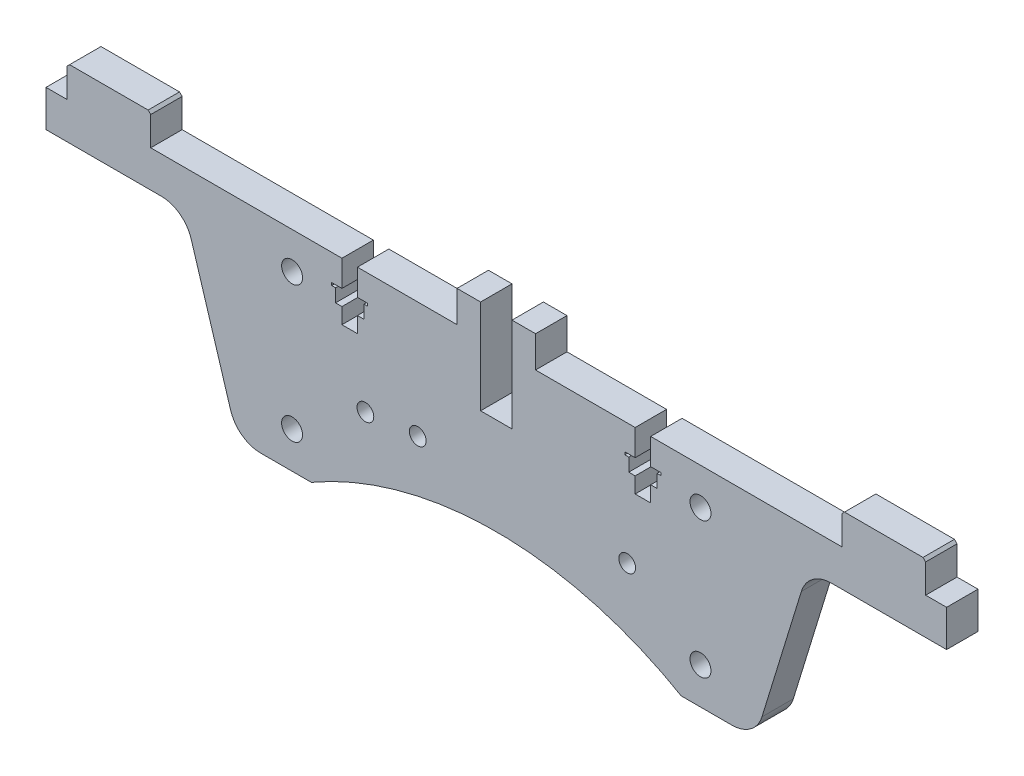
from build123d import *

# Parameters (mm, degrees)
BOSS_EXTRUDE1_DEPTH = 6
SKETCH2_R           = 2
SKETCH2_R_2         = 1.6
CUT_EXTRUDE1_DEPTH  = 91.044433476
CHAMFER1_SIZE       = 0.5
CUT_EXTRUDE2_DEPTH  = 91.044433476
SKETCH5_R           = 1.6
CUT_EXTRUDE3_DEPTH  = 91.044433476


with BuildPart() as part:
    # Sketch1 → Boss-Extrude1 (new body)
    with BuildSketch(Plane.XY):
        with BuildLine():
            Line((-7.5, 20), (-66, 20))
            Line((-66, 20), (-66, 26))
            Line((-66, 26), (-82, 26))
            Line((-82, 26), (-82, 20))
            Line((-82, 20), (-86, 20))
            Line((-86, 20), (-86, 13))
            Line((-86, 13), (-64, 13))
            ThreePointArc((-64, 13), (-60.433883594, 11.825226811), (-58.264226502, 8.760937927))
            Line((-58.264226502, 8.760937927), (-50.735773498, -15.760937927))
            ThreePointArc((-50.735773498, -15.760937927), (-48.566116406, -18.825226811), (-45, -20))
            Line((-45, -20), (-35.321388767, -20))
            ThreePointArc((-35.321388767, -20), (0, -10.5), (35.321388767, -20))
            Line((35.321388767, -20), (45, -20))
            ThreePointArc((45, -20), (48.566116406, -18.825226811), (50.735773498, -15.760937927))
            Line((50.735773498, -15.760937927), (58.264226502, 8.760937927))
            ThreePointArc((58.264226502, 8.760937927), (60.433883594, 11.825226811), (64, 13))
            Line((64, 13), (86, 13))
            Line((86, 13), (86, 20))
            Line((86, 20), (82, 20))
            Line((82, 20), (82, 26))
            Line((82, 26), (66, 26))
            Line((66, 26), (66, 20))
            Line((66, 20), (7.5, 20))
            Line((7.5, 20), (7.5, 26))
            Line((7.5, 26), (3, 26))
            Line((3, 26), (3, 8))
            Line((3, 8), (-3, 8))
            Line((-3, 8), (-3, 26))
            Line((-3, 26), (-7.5, 26))
            Line((-7.5, 26), (-7.5, 20))
        make_face()
    extrude(amount=BOSS_EXTRUDE1_DEPTH)

    # Sketch2 → Cut-Extrude1 (cut, through all)
    with BuildSketch(Plane.XY.offset(6)):
        with Locations((39, -13)):
            Circle(SKETCH2_R)
        with Locations((39, 13)):
            Circle(SKETCH2_R)
        with Locations((25, -3.2)):
            Circle(SKETCH2_R_2)
        with Locations((-25, -3.2)):
            Circle(SKETCH2_R_2)
    cut_extrude1 = extrude(amount=-CUT_EXTRUDE1_DEPTH, mode=Mode.SUBTRACT)

    # Mirror1: Cut-Extrude1 across plane
    add(cut_extrude1.mirror(Plane(origin=(0, 0, 0), x_dir=(0, 0, 1), z_dir=(1, 0, 0))), mode=Mode.SUBTRACT)

    # Chamfer1
    chamfer1_edges = [part.edges().sort_by_distance(p)[0] for p in [
        (66, 26, 3),
        (82, 26, 3),
        (-66, 26, 3),
        (-82, 26, 3),
    ]]
    chamfer(chamfer1_edges, length=CHAMFER1_SIZE)

    # Sketch4 → Cut-Extrude2 (cut, through all)
    with BuildSketch(Plane.XY.offset(6)):
        Polygon((-29.48, 20), (-29.48, 15), (-31.45, 15), (-31.45, 14.5), (-30.7, 14.5), (-30.7, 12), (-29.48, 12), (-29.48, 9), (-26.52, 9), (-26.52, 12), (-25.3, 12), (-25.3, 14.5), (-24.55, 14.5), (-24.55, 15), (-26.52, 15), (-26.52, 20), align=None)
        Polygon((26.52, 20), (26.52, 15), (24.55, 15), (24.55, 14.5), (25.3, 14.5), (25.3, 12), (26.52, 12), (26.52, 9), (29.48, 9), (29.48, 12), (30.7, 12), (30.7, 14.5), (31.45, 14.5), (31.45, 15), (29.48, 15), (29.48, 20), align=None)
    extrude(amount=-CUT_EXTRUDE2_DEPTH, mode=Mode.SUBTRACT)

    # Sketch5 → Cut-Extrude3 (cut, through all)
    with BuildSketch(Plane.XY.offset(6)):
        with Locations((-15, -2.2)):
            Circle(SKETCH5_R)
    extrude(amount=-CUT_EXTRUDE3_DEPTH, mode=Mode.SUBTRACT)


solid = part.part
